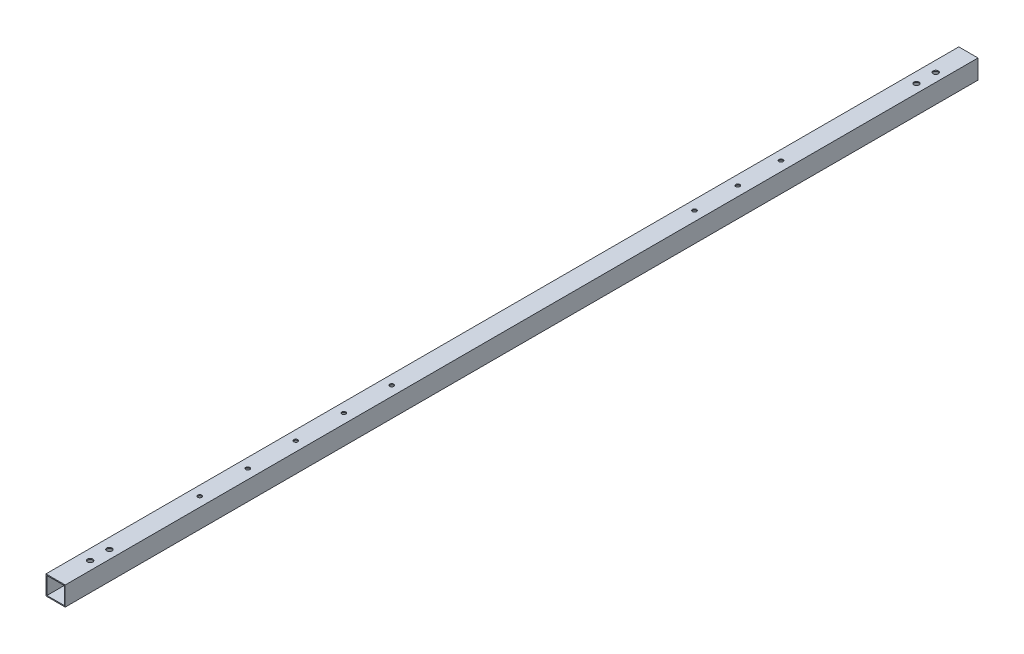
from build123d import *

# Parameters (mm, degrees)
SKETCH_1_W          = 20
SKETCH_1_H          = 20
SKETCH_1_W_2        = 18
SKETCH_1_H_2        = 18
EXTRUDE_1_DEPTH     = 950
SKETCH_2_R          = 2.75
CUT_EXTRUDE_1_DEPTH = 37
SKETCH_3_R          = 2.1
CUT_EXTRUDE_2_DEPTH = 37
SKETCH_4_R          = 2.1
CUT_EXTRUDE_3_DEPTH = 37


with BuildPart() as part:
    # 草图1 → 拉伸-薄壁1 (new body)
    with BuildSketch(Plane.XY):
        with Locations((10, -10)):
            Rectangle(SKETCH_1_W, SKETCH_1_H)
        with Locations((10, -10)):
            Rectangle(SKETCH_1_W_2, SKETCH_1_H_2, mode=Mode.SUBTRACT)
    extrude(amount=EXTRUDE_1_DEPTH)

    # 草图2 → 切除-拉伸1 (cut)
    with BuildSketch(Plane(origin=(0, 0, 0), x_dir=(1, 0, 0), z_dir=(0, 1, 0))):
        with Locations((11, -35)):
            Circle(SKETCH_2_R)
        with Locations((11, -55)):
            Circle(SKETCH_2_R)
        with Locations((11, -895)):
            Circle(SKETCH_2_R)
        with Locations((11, -915)):
            Circle(SKETCH_2_R)
    extrude(amount=-CUT_EXTRUDE_1_DEPTH, mode=Mode.SUBTRACT)

    # 草图3 → 切除-拉伸2 (cut)
    with BuildSketch(Plane(origin=(0, 0, 0), x_dir=(1, 0, 0), z_dir=(0, 1, 0))):
        with Locations((10, -195)):
            Circle(SKETCH_3_R)
        with Locations((10, -240)):
            Circle(SKETCH_3_R)
        with Locations((10, -285)):
            Circle(SKETCH_3_R)
    extrude(amount=-CUT_EXTRUDE_2_DEPTH, mode=Mode.SUBTRACT)

    # 草图4 → 切除-拉伸3 (cut)
    with BuildSketch(Plane(origin=(0, 0, 0), x_dir=(1, 0, 0), z_dir=(0, 1, 0))):
        with Locations((10, -800)):
            Circle(SKETCH_4_R)
        with Locations((10, -750)):
            Circle(SKETCH_4_R)
        with Locations((10, -700)):
            Circle(SKETCH_4_R)
        with Locations((10, -650)):
            Circle(SKETCH_4_R)
        with Locations((10, -600)):
            Circle(SKETCH_4_R)
    extrude(amount=-CUT_EXTRUDE_3_DEPTH, mode=Mode.SUBTRACT)


solid = part.part
